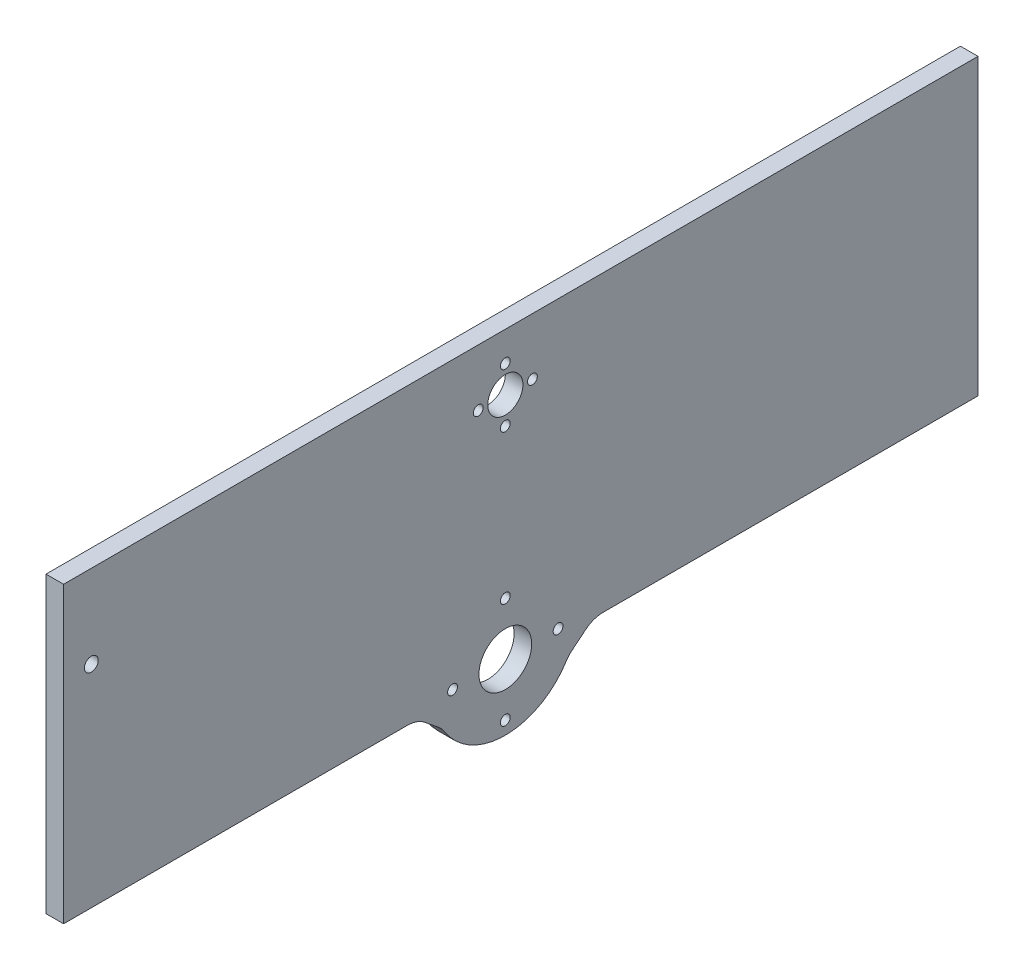
from build123d import *

# Parameters (mm, degrees)
SKETCH1_W                                     = 330.2
SKETCH1_H                                     = 127
MAIN_PLATE_SIZE_DEPTH                         = 6.35
SKETCH2_R                                     = 9.525
SKETCH2_R_2                                   = 1.778
BOTTOM_SHAFT_MOUNTING_HOLES_DEPTH             = 354.83804558
SKETCH3_R                                     = 6.35
SKETCH3_R_2                                   = 1.778
TOP_BATTERY_BOX_MOUNTING_HOLES_DEPTH          = 354.83804558
THIS_IS_TO_MATCH_THE_IDIOTIC_DESIGN_OF_B_SIZE = 6.35
THIS_IS_TO_MATCH_THE_IDIOTIC_DESIGN_2_R       = 10
SKETCH4_R                                     = 2.5
F_20MM_EXTRUSION_MOUNT_DEPTH                  = 354.83804558


with BuildPart() as part:
    # Sketch1 → Main Plate Size (new body)
    with BuildSketch(Plane(origin=(0, 0, 0), x_dir=(0, 0, -1), z_dir=(1, 0, 0))):
        with Locations((165.1, 63.5)):
            Rectangle(SKETCH1_W, SKETCH1_H)
    extrude(amount=MAIN_PLATE_SIZE_DEPTH)

    # Sketch2 → Bottom Shaft Mounting Holes (cut, through all)
    with BuildSketch(Plane(origin=(6.35, 0, 0), x_dir=(0, 0, -1), z_dir=(1, 0, 0))):
        with BuildLine():
            Line((134.1120127, 20.8026), (0, 20.8026))
            Line((0, 20.8026), (0, 0))
            Line((0, 0), (159.512000023, 0))
            ThreePointArc((159.512000023, 0), (143.096249024, 5.864358018), (134.1120127, 20.8026))
        make_face()
        with BuildLine():
            ThreePointArc((184.9119873, 20.8026), (175.927750994, 5.864358033), (159.512000023, 0))
            Line((159.512000023, 0), (177.8, 0))
            Line((177.8, 0), (330.2, 0))
            Line((330.2, 0), (330.2, 20.8026))
            Line((330.2, 20.8026), (184.9119873, 20.8026))
        make_face()
        with Locations((159.512, 23.8252)):
            Circle(SKETCH2_R)
        with Locations((159.512, 4.7752)):
            Circle(SKETCH2_R_2)
        with Locations((178.562, 23.8252)):
            Circle(SKETCH2_R_2)
        with Locations((159.512, 42.8752)):
            Circle(SKETCH2_R_2)
        with Locations((140.462, 23.8252)):
            Circle(SKETCH2_R_2)
    extrude(amount=-BOTTOM_SHAFT_MOUNTING_HOLES_DEPTH, mode=Mode.SUBTRACT)

    # Sketch3 → Top Battery Box Mounting Holes (cut, through all)
    with BuildSketch(Plane(origin=(6.35, 0, 0), x_dir=(0, 0, -1), z_dir=(1, 0, 0))):
        with Locations((159.512, 106.5022)):
            Circle(SKETCH3_R)
        with Locations((149.733, 106.5022)):
            Circle(SKETCH3_R_2)
        with Locations((159.512, 116.2812)):
            Circle(SKETCH3_R_2)
        with Locations((169.291, 106.5022)):
            Circle(SKETCH3_R_2)
        with Locations((159.512, 96.7232)):
            Circle(SKETCH3_R_2)
    extrude(amount=-TOP_BATTERY_BOX_MOUNTING_HOLES_DEPTH, mode=Mode.SUBTRACT)

    # This is to match the idiotic Design of B
    # the kernel refuses this chamfer: 6.35 mm, written as the material it adds along each edge
    with BuildSketch(Plane(origin=(6.35, 20.8026, -134.1120127), x_dir=(0, -0.9387383646661532, -0.34463064678568023), z_dir=(-1, 0, 0))) as this_is_to_match_the_idiotic_design_of_b_piece_1:
        with BuildLine():
            Line((7.921958409, 0), (-THIS_IS_TO_MATCH_THE_IDIOTIC_DESIGN_OF_B_SIZE * 0.344630646786, THIS_IS_TO_MATCH_THE_IDIOTIC_DESIGN_OF_B_SIZE * 0.938738364666))
            Line((-THIS_IS_TO_MATCH_THE_IDIOTIC_DESIGN_OF_B_SIZE * 0.344630646786, THIS_IS_TO_MATCH_THE_IDIOTIC_DESIGN_OF_B_SIZE * 0.938738364666), (0, 0))
            ThreePointArc((0, 0), (4.071959946, 0.304342453), (7.921958409, 0))
        make_face()
    extrude(amount=6.35)
    with BuildSketch(Plane(origin=(6.35, 20.8026, -184.9119873), x_dir=(0, -0.9387383646661542, 0.34463064678567756), z_dir=(-1, 0, 0))) as this_is_to_match_the_idiotic_design_of_b_piece_2:
        with BuildLine():
            Line((7.921958409, 0), (-THIS_IS_TO_MATCH_THE_IDIOTIC_DESIGN_OF_B_SIZE * 0.344630646786, -THIS_IS_TO_MATCH_THE_IDIOTIC_DESIGN_OF_B_SIZE * 0.938738364666))
            Line((-THIS_IS_TO_MATCH_THE_IDIOTIC_DESIGN_OF_B_SIZE * 0.344630646786, -THIS_IS_TO_MATCH_THE_IDIOTIC_DESIGN_OF_B_SIZE * 0.938738364666), (0, 0))
            ThreePointArc((0, 0), (4.071959946, -0.304342453), (7.921958409, 0))
        make_face()
    extrude(amount=6.35)

    # This is to match the idiotic Design  2
    this_is_to_match_the_idiotic_design_2_edges = [part.edges().sort_by_distance(p)[0] for p in [
        (3.175, 13.365953718, -136.84216235),
        (3.175, 13.365953718, -182.18183765),
        (3.175, 20.8026, -191.2619873),
        (3.175, 20.8026, -127.7620127),
    ]]
    fillet(this_is_to_match_the_idiotic_design_2_edges, radius=THIS_IS_TO_MATCH_THE_IDIOTIC_DESIGN_2_R)

    # Sketch4 → 20mm Extrusion Mount (cut, through all)
    with BuildSketch(Plane(origin=(6.35, 0, 0), x_dir=(0, 0, -1), z_dir=(1, 0, 0))):
        with Locations((10, 97.0026)):
            Circle(SKETCH4_R)
    extrude(amount=-F_20MM_EXTRUSION_MOUNT_DEPTH, mode=Mode.SUBTRACT)


solid = part.part
